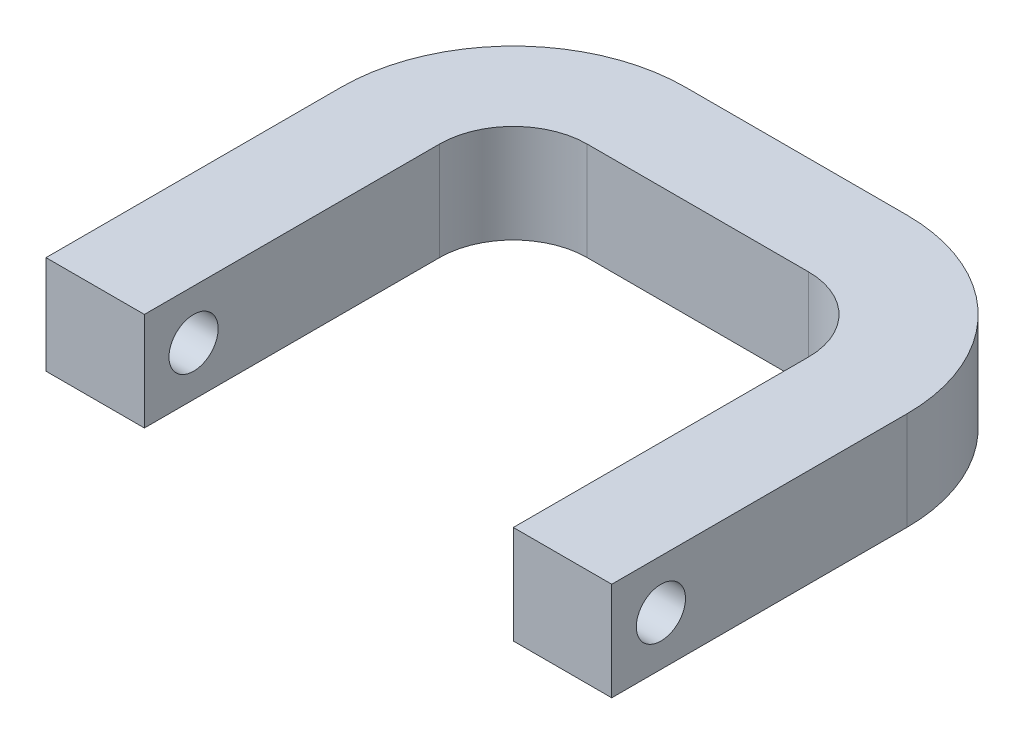
from build123d import *

# Parameters (mm, degrees)
BOSS_EXTRUDE1_DEPTH      = 4
BOSS_EXTRUDE1_DEPTH_BACK = 4
CUT_EXTRUDE1_DEPTH       = 54.888774341
CUT_EXTRUDE1_DEPTH_BACK  = 54.888774341
SKETCH2_R                = 2


with BuildPart() as part:
    # Sketch1 → Boss-Extrude1 (new, two sides: drawn at the far end of the back side and taken through both)
    with BuildSketch(Plane(origin=(0, 0, 0), x_dir=(1, 0, 0), z_dir=(0, 1, 0)).offset(-BOSS_EXTRUDE1_DEPTH_BACK)):
        with BuildLine():
            Line((-9, 0), (9, 0))
            ThreePointArc((9, 0), (18.899494937, -4.100505063), (23, -14))
            Line((23, -14), (23, -38))
            Line((23, -38), (15, -38))
            Line((15, -38), (15, -14))
            ThreePointArc((15, -14), (13.242640687, -9.757359313), (9, -8))
            Line((9, -8), (-9, -8))
            ThreePointArc((-9, -8), (-13.242640687, -9.757359313), (-15, -14))
            Line((-15, -14), (-15, -38))
            Line((-15, -38), (-23, -38))
            Line((-23, -38), (-23, -14))
            ThreePointArc((-23, -14), (-18.899494937, -4.100505063), (-9, 0))
        make_face()
    extrude(amount=BOSS_EXTRUDE1_DEPTH + BOSS_EXTRUDE1_DEPTH_BACK)

    # Sketch2 → Cut-Extrude1 (cut, two sides: drawn at the far end of the back side and taken through both)
    with BuildSketch(Plane.ZY.offset(-15).offset(-CUT_EXTRUDE1_DEPTH_BACK)):
        with Locations((34, 0)):
            Circle(SKETCH2_R)
    extrude(amount=CUT_EXTRUDE1_DEPTH + CUT_EXTRUDE1_DEPTH_BACK, mode=Mode.SUBTRACT)


solid = part.part
